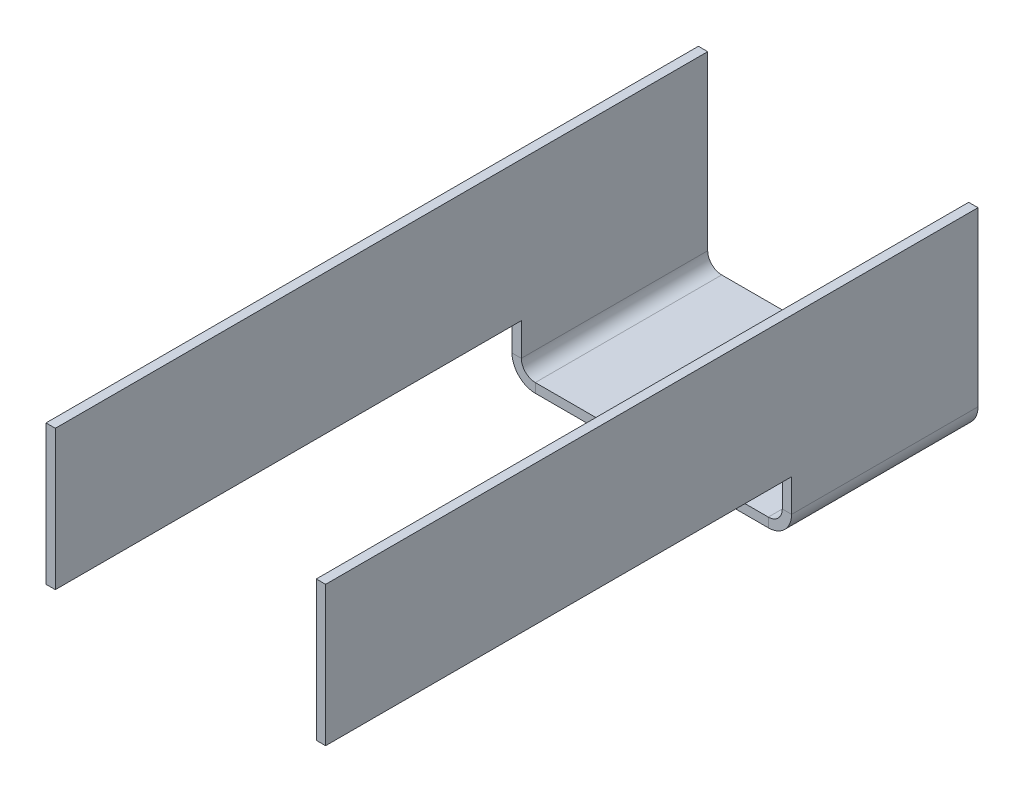
from build123d import *

# Parameters (mm, degrees)
SKETCH1_W          = 25
SKETCH1_H          = 20
BASE_FLANGE1_DEPTH = 1
EDGE_FLANGE1_DEPTH = 20
EDGE_FLANGE2_DEPTH = 20
SKETCH15_W         = 50
SKETCH15_H         = 15
TAB1_DEPTH         = 1
SKETCH18_W         = 50
SKETCH18_H         = 15
TAB2_DEPTH         = 1


# Sheet-metal steps are written as plain solids
with BuildPart() as part:
    # Sketch1 → Base-Flange1 (new body)
    with BuildSketch(Plane(origin=(0, 0, 0), x_dir=(1, 0, 0), z_dir=(0, 1, 0))):
        Rectangle(SKETCH1_W, SKETCH1_H)
    extrude(amount=-BASE_FLANGE1_DEPTH)

    # Edge-Flange1 section (across the edge) → Edge-Flange1 (add)
    with BuildSketch(Plane(origin=(-14, 0, -10), x_dir=(1, 0, 0), z_dir=(0, 0, 1))):
        with BuildLine():
            Line((-1, 1.5), (-1, 20))
            Line((-1, 20), (0, 20))
            Line((0, 20), (0, 1.5))
            ThreePointArc((0, 1.5), (0.439339828, 0.439339828), (1.5, 0))
            Line((1.5, 0), (1.5, -1))
            ThreePointArc((1.5, -1), (-0.267766953, -0.267766953), (-1, 1.5))
        make_face()
    extrude(amount=EDGE_FLANGE1_DEPTH)

    # Edge-Flange2 section (across the edge) → Edge-Flange2 (add)
    with BuildSketch(Plane(origin=(14, 0, 10), x_dir=(-1, 0, 0), z_dir=(0, 0, -1))):
        with BuildLine():
            Line((-1, 1.5), (-1, 20))
            Line((-1, 20), (0, 20))
            Line((0, 20), (0, 1.5))
            ThreePointArc((0, 1.5), (0.439339828, 0.439339828), (1.5, 0))
            Line((1.5, 0), (1.5, -1))
            ThreePointArc((1.5, -1), (-0.267766953, -0.267766953), (-1, 1.5))
        make_face()
    extrude(amount=EDGE_FLANGE2_DEPTH)

    # Sketch15 → Tab1 (add)
    with BuildSketch(Plane(origin=(-14, 0, 0), x_dir=(0, 0, -1), z_dir=(1, 0, 0))):
        with Locations((-35, 12.5)):
            Rectangle(SKETCH15_W, SKETCH15_H)
    extrude(amount=-TAB1_DEPTH)

    # Sketch18 → Tab2 (add)
    with BuildSketch(Plane(origin=(15, 0, 0), x_dir=(0, 0, -1), z_dir=(1, 0, 0))):
        with Locations((-35, 12.5)):
            Rectangle(SKETCH18_W, SKETCH18_H)
    extrude(amount=-TAB2_DEPTH)


solid = part.part
